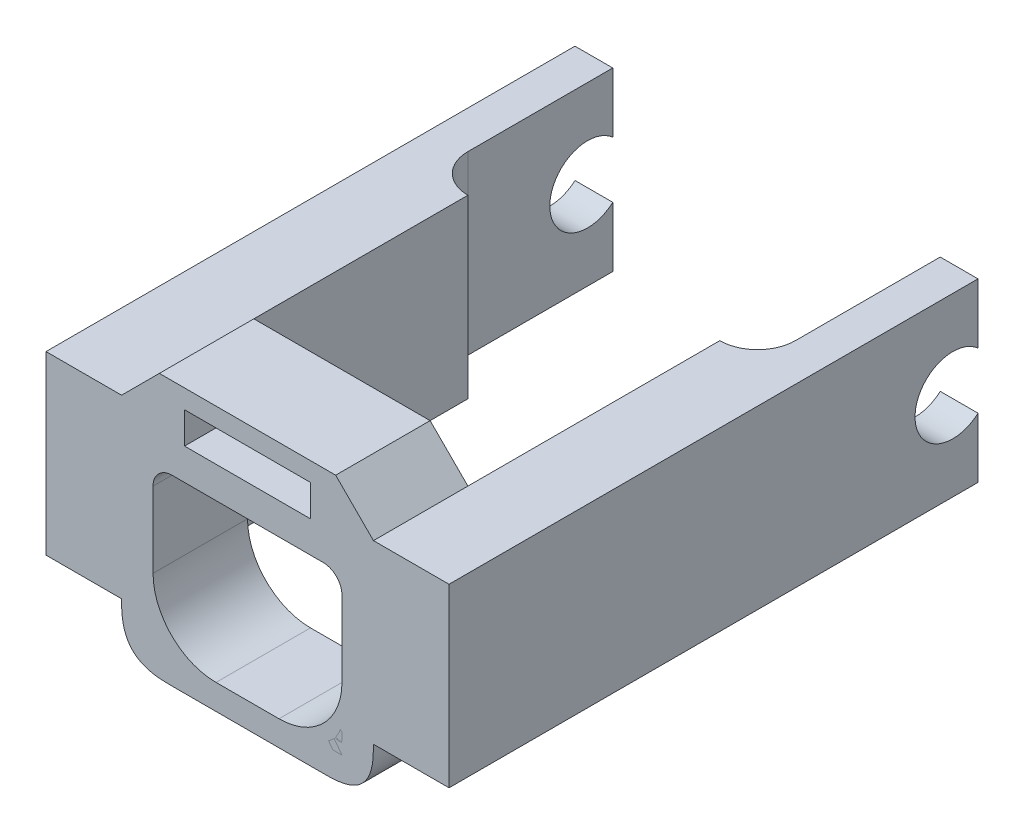
from build123d import *

# Parameters (mm, degrees)
SKETCH1_W               = 20
SKETCH1_H               = 21
SKETCH1_W_2             = 15
SKETCH1_H_2             = 12.5
BOSS_EXTRUDE1_DEPTH     = 7.5
FILLET1_SIZE            = 4
BOSS_EXTRUDE2_DEPTH     = 7.5
BOSS_EXTRUDE3_DEPTH     = 7.5
BOSS_EXTRUDE4_DEPTH     = 7.5
BOSS_EXTRUDE5_DEPTH     = 7.5
CHAMFER1_SIZE           = 3
SKETCH8_W               = 10
SKETCH8_H               = 2.5
CUT_EXTRUDE1_DEPTH      = 7.5
BOSS_EXTRUDE10_START    = -7.5
SKETCH19_W              = 6
SKETCH19_H              = 14
BOSS_EXTRUDE10_DEPTH    = 52.5
CUT_EXTRUDE5_DEPTH      = 54.863252857
CUT_EXTRUDE5_DEPTH_BACK = 15
FILLET2_R               = 3
CUT_EXTRUDE16_DEPTH     = 3
FILLET3_R               = 3
CUT_EXTRUDE17_DEPTH     = 35


# Some blends are built 0.0001 mm under size
with BuildPart() as part:
    # Sketch1 → Boss-Extrude1 (new body)
    with BuildSketch(Plane.XY):
        with Locations((-7.5, -4)):
            Rectangle(SKETCH1_W, SKETCH1_H)
        with Locations((-7.5, -6.25)):
            Rectangle(SKETCH1_W_2, SKETCH1_H_2, mode=Mode.SUBTRACT)
    extrude(amount=BOSS_EXTRUDE1_DEPTH)

    # Fillet1
    # a fillet whose section is not a circle: 4 mm, written as the material it takes off along each edge
    with BuildSketch(Plane(origin=(-17.5, -14.5, -10), x_dir=(0, 1, 0), z_dir=(0, 0, 1)), Plane(origin=(2.5, -14.5, -10), x_dir=(-1, 0, 0), z_dir=(0, 0, 1))) as fillet1_piece_1:
        with BuildLine():
            add(Edge.make_bspline([(FILLET1_SIZE, 0), (FILLET1_SIZE * 0.831801948466, 0), (FILLET1_SIZE * 0.663603896932, 0), (FILLET1_SIZE * 0.292893218813, -FILLET1_SIZE * 0.0716919198361), (FILLET1_SIZE * 0.0716919198361, -FILLET1_SIZE * 0.292893218813), (0, -FILLET1_SIZE * 0.663603896932), (0, -FILLET1_SIZE * 0.831801948466), (0, -FILLET1_SIZE)], knots=[0, 0, 0, 0, 0, 0, 0.5, 0.5, 1, 1, 1, 1, 1, 1], degree=5))
            Line((0, -FILLET1_SIZE), (0, 0))
            Line((0, 0), (FILLET1_SIZE, 0))
        make_face()
    extrude(amount=27.5, mode=Mode.SUBTRACT)

    # Sketch3 → Boss-Extrude2 (add)
    with BuildSketch(Plane.XY.offset(7.5)):
        with BuildLine():
            Line((-13.5, 0), (-15, 0))
            Line((-15, 0), (-15, -1.5))
            ThreePointArc((-15, -1.5), (-14.560660172, -0.439339828), (-13.5, 0))
        make_face()
    extrude(amount=-BOSS_EXTRUDE2_DEPTH)

    # Sketch4 → Boss-Extrude3 (add)
    with BuildSketch(Plane.XY.offset(7.5)):
        with BuildLine():
            Line((0, 0), (0, -1.495394009))
            ThreePointArc((0, -1.495394009), (-0.437990765, -0.437990765), (-1.495394009, 0))
            Line((-1.495394009, 0), (0, 0))
        make_face()
    extrude(amount=-BOSS_EXTRUDE3_DEPTH)

    # Sketch7 → Boss-Extrude5 (add)
    with BuildSketch(Plane.XY.offset(7.5)):
        with BuildLine():
            Line((-15, -12.5), (-10, -12.5))
            ThreePointArc((-10, -12.5), (-13.535533906, -11.035533906), (-15, -7.5))
            Line((-15, -7.5), (-15, -12.5))
        make_face()
        with BuildLine():
            Line((0, -12.5), (-5, -12.5))
            ThreePointArc((-5, -12.5), (-1.464466094, -11.035533906), (0, -7.5))
            Line((0, -7.5), (0, -12.5))
        make_face()
    extrude(amount=-BOSS_EXTRUDE5_DEPTH)

    # Chamfer1
    chamfer1_edges = [part.edges().sort_by_distance(p)[0] for p in [
        (2.5, 6.5, 3.75),
        (-17.5, 6.5, 3.75),
    ]]
    chamfer(chamfer1_edges, length=CHAMFER1_SIZE)

    # Sketch8 → Cut-Extrude1 (cut)
    with BuildSketch(Plane.XY.offset(7.5)):
        with Locations((-7.5, 3.75)):
            Rectangle(SKETCH8_W, SKETCH8_H)
    extrude(amount=-CUT_EXTRUDE1_DEPTH, mode=Mode.SUBTRACT)

    # Sketch19 → Boss-Extrude10 (add)
    with BuildSketch(Plane(origin=(0, 0, 0), x_dir=(-1, 0, 0), z_dir=(0, 0, -1)).offset(BOSS_EXTRUDE10_START)):
        with Locations((20.5, -3.5)):
            Rectangle(SKETCH19_W, SKETCH19_H)
    boss_extrude10 = extrude(amount=BOSS_EXTRUDE10_DEPTH)

    # Sketch24 → Cut-Extrude5 (cut, two sides: drawn at the far end of the back side and taken through both)
    with BuildSketch(Plane(origin=(0, 3.5, 0), x_dir=(1, 0, 0), z_dir=(0, 1, 0)).offset(-CUT_EXTRUDE5_DEPTH_BACK)):
        Polygon((-20.5, 169.634201094), (-20.5, 45), (-20.5, 20), (-17.5, 20), (107.134201094, 20), (296.782917214, 181.765573603), (169.14871612, 331.399774696), align=None)
    extrude(amount=CUT_EXTRUDE5_DEPTH + CUT_EXTRUDE5_DEPTH_BACK, mode=Mode.SUBTRACT)

    # Fillet2
    fillet2_edges = [part.edges().sort_by_distance(p)[0] for p in [
        (-20.5, -3.5, -20),
    ]]
    fillet(fillet2_edges, radius=FILLET2_R - 0.0001)  # a hair under: the kernel refuses the full size

    # Mirror4: Boss-Extrude10 across plane
    add(boss_extrude10.mirror(Plane.ZY.offset(7.5)))

    # Sketch32 → Cut-Extrude16 (cut)
    with BuildSketch(Plane.ZY.offset(-2.5)):
        Polygon((-20, 3.5), (-20, -10.5), (-44.524944587, -10.5), (-45, -10.5), (-45, 3.5), (-20.308747934, 3.5), align=None)
    extrude(amount=-CUT_EXTRUDE16_DEPTH, mode=Mode.SUBTRACT)

    # Fillet3
    fillet3_edges = [part.edges().sort_by_distance(p)[0] for p in [
        (5.5, -3.5, -20),
    ]]
    fillet(fillet3_edges, radius=FILLET3_R - 0.0001)  # a hair under: the kernel refuses the full size

    # Sketch33 → Cut-Extrude17 (cut)
    with BuildSketch(Plane(origin=(8.5, 0, 0), x_dir=(0, 0, -1), z_dir=(1, 0, 0))):
        with BuildLine():
            ThreePointArc((35.5, -3.5), (35.238612788, -2.275255129), (34.5, -1.263932023))
            Line((34.5, -1.263932023), (34.5, -5.736067977))
            ThreePointArc((34.5, -5.736067977), (35.238612788, -4.724744871), (35.5, -3.5))
        make_face()
        with BuildLine():
            Line((34.5, -5.736067977), (34.5, -1.263932023))
            ThreePointArc((34.5, -1.263932023), (29.5, -3.5), (34.5, -5.736067977))
        make_face()
        with BuildLine():
            Line((45, -10.5), (45, 3.5))
            Line((45, 3.5), (34.5, 3.5))
            Line((34.5, 3.5), (34.5, -1.263932023))
            ThreePointArc((34.5, -1.263932023), (35.238612788, -2.275255129), (35.5, -3.5))
            ThreePointArc((35.5, -3.5), (35.238612788, -4.724744871), (34.5, -5.736067977))
            Line((34.5, -5.736067977), (34.5, -10.5))
            Line((34.5, -10.5), (45, -10.5))
        make_face()
    extrude(amount=-CUT_EXTRUDE17_DEPTH, mode=Mode.SUBTRACT)


with BuildPart() as body_2:
    # Sketch6 → Boss-Extrude4 (new body)
    with BuildSketch(Plane.XY.offset(7.5)):
        with BuildLine():
            Line((0, -12.5), (0, -10))
            ThreePointArc((0, -10), (-0.732233047, -11.767766953), (-2.5, -12.5))
            Line((-2.5, -12.5), (0, -12.5))
        make_face()
    extrude(amount=-BOSS_EXTRUDE4_DEPTH)


solid = Compound([part.part, body_2.part])
